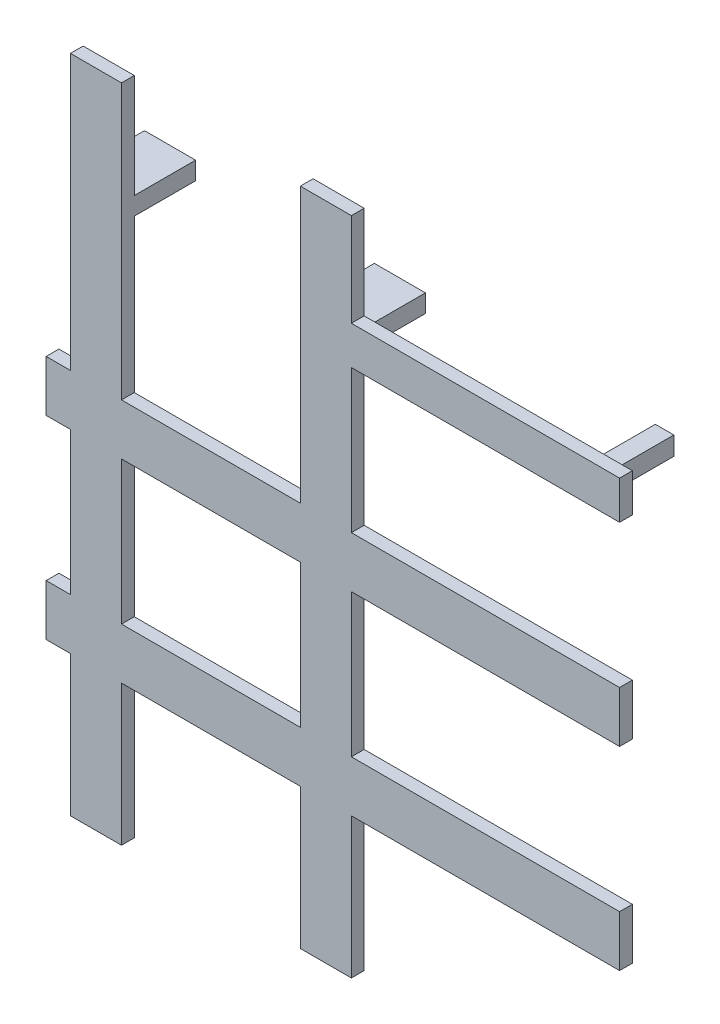
from build123d import *

# Parameters (mm, degrees)
SCHIZZO1_W                        = 4
SCHIZZO1_H                        = 51.7
ESTRUSIONE_ESTRUSIONE1_DEPTH      = 1
ESTRUSIONE_ESTRUSIONE2_DEPTH      = 18
ESTRUSIONE_ESTRUSIONE2_DEPTH_BACK = 5.9
SCHIZZO2_W                        = 1
SCHIZZO2_H                        = 4
ESTRUSIONE_ESTRUSIONE3_DEPTH      = 18
ESTRUSIONE_ESTRUSIONE3_DEPTH_BACK = 5.9
SCHIZZO3_W                        = 1
SCHIZZO3_H                        = 4
ESTRUSIONE_ESTRUSIONE4_DEPTH      = 21.5
ESTRUSIONE_ESTRUSIONE4_DEPTH_BACK = 30.2
SCHIZZO4_W                        = 4
SCHIZZO4_H                        = 1
SCHIZZO5_W                        = 1
SCHIZZO5_H                        = 3
ESTRUSIONE_ESTRUSIONE5_DEPTH      = 21
SCHIZZO7_W                        = 1
SCHIZZO7_H                        = 4
ESTRUSIONE_ESTRUSIONE6_DEPTH      = 21
SCHIZZO8_W                        = 1
SCHIZZO8_H                        = 4
ESTRUSIONE_ESTRUSIONE7_DEPTH      = 21
SCHIZZO10_W                       = 4
SCHIZZO10_H                       = 1.4
ESTRUSIONE_ESTRUSIONE9_DEPTH      = 4.8
SCHIZZO11_W                       = 4
SCHIZZO11_H                       = 1.4
ESTRUSIONE_ESTRUSIONE10_DEPTH     = 4.8
SCHIZZO12_W                       = 1.45
SCHIZZO12_H                       = 1.45
ESTRUSIONE_ESTRUSIONE11_DEPTH     = 4.8


with BuildPart() as part:
    # Schizzo1 → Estrusione-Estrusione1 (new body)
    with BuildSketch(Plane.XY):
        with Locations((2, 25.85)):
            Rectangle(SCHIZZO1_W, SCHIZZO1_H)
    extrude(amount=ESTRUSIONE_ESTRUSIONE1_DEPTH)

    # Schizzo2 → Estrusione-Estrusione2 (add, two sides: drawn at the far end of the back side and taken through both)
    with BuildSketch(Plane(origin=(4, 0, 0), x_dir=(0, 0, -1), z_dir=(1, 0, 0)).offset(-ESTRUSIONE_ESTRUSIONE2_DEPTH_BACK)):
        with Locations((-0.5, 28.2)):
            Rectangle(SCHIZZO2_W, SCHIZZO2_H)
    extrude(amount=ESTRUSIONE_ESTRUSIONE2_DEPTH + ESTRUSIONE_ESTRUSIONE2_DEPTH_BACK)

    # Schizzo3 → Estrusione-Estrusione3 (add, two sides: drawn at the far end of the back side and taken through both)
    with BuildSketch(Plane(origin=(4, 0, 0), x_dir=(0, 0, -1), z_dir=(1, 0, 0)).offset(-ESTRUSIONE_ESTRUSIONE3_DEPTH_BACK)):
        with Locations((-0.5, 13)):
            Rectangle(SCHIZZO3_W, SCHIZZO3_H)
    extrude(amount=ESTRUSIONE_ESTRUSIONE3_DEPTH + ESTRUSIONE_ESTRUSIONE3_DEPTH_BACK)

    # Schizzo4 → Estrusione-Estrusione4 (add, two sides: drawn at the far end of the back side and taken through both)
    with BuildSketch(Plane(origin=(0, 30.2, 0), x_dir=(1, 0, 0), z_dir=(0, 1, 0)).offset(-ESTRUSIONE_ESTRUSIONE4_DEPTH_BACK)):
        with Locations((20, -0.5)):
            Rectangle(SCHIZZO4_W, SCHIZZO4_H)
    extrude(amount=ESTRUSIONE_ESTRUSIONE4_DEPTH + ESTRUSIONE_ESTRUSIONE4_DEPTH_BACK)

    # Schizzo5 → Estrusione-Estrusione5 (add)
    with BuildSketch(Plane(origin=(22, 0, 0), x_dir=(0, 0, -1), z_dir=(1, 0, 0))):
        with Locations((-0.5, 42.898738045)):
            Rectangle(SCHIZZO5_W, SCHIZZO5_H)
    extrude(amount=ESTRUSIONE_ESTRUSIONE5_DEPTH)

    # Schizzo7 → Estrusione-Estrusione6 (add)
    with BuildSketch(Plane(origin=(22, 0, 0), x_dir=(0, 0, -1), z_dir=(1, 0, 0))):
        with Locations((-0.5, 13)):
            Rectangle(SCHIZZO7_W, SCHIZZO7_H)
    extrude(amount=ESTRUSIONE_ESTRUSIONE6_DEPTH)

    # Schizzo8 → Estrusione-Estrusione7 (add)
    with BuildSketch(Plane(origin=(22, 0, 0), x_dir=(0, 0, -1), z_dir=(1, 0, 0))):
        with Locations((-0.5, 28.2)):
            Rectangle(SCHIZZO8_W, SCHIZZO8_H)
    extrude(amount=ESTRUSIONE_ESTRUSIONE7_DEPTH)

    # Schizzo10 → Estrusione-Estrusione9 (add)
    with BuildSketch(Plane(origin=(0, 0, 0), x_dir=(-1, 0, 0), z_dir=(0, 0, -1))):
        with Locations((-2, 42.86)):
            Rectangle(SCHIZZO10_W, SCHIZZO10_H)
    extrude(amount=ESTRUSIONE_ESTRUSIONE9_DEPTH)

    # Schizzo11 → Estrusione-Estrusione10 (add)
    with BuildSketch(Plane(origin=(0, 0, 0), x_dir=(-1, 0, 0), z_dir=(0, 0, -1))):
        with Locations((-20, 42.86)):
            Rectangle(SCHIZZO11_W, SCHIZZO11_H)
    extrude(amount=ESTRUSIONE_ESTRUSIONE10_DEPTH)

    # Schizzo12 → Estrusione-Estrusione11 (add)
    with BuildSketch(Plane(origin=(0, 0, 0), x_dir=(-1, 0, 0), z_dir=(0, 0, -1))):
        with Locations((-40.725, 42.923738045)):
            Rectangle(SCHIZZO12_W, SCHIZZO12_H)
    extrude(amount=ESTRUSIONE_ESTRUSIONE11_DEPTH)


solid = part.part
